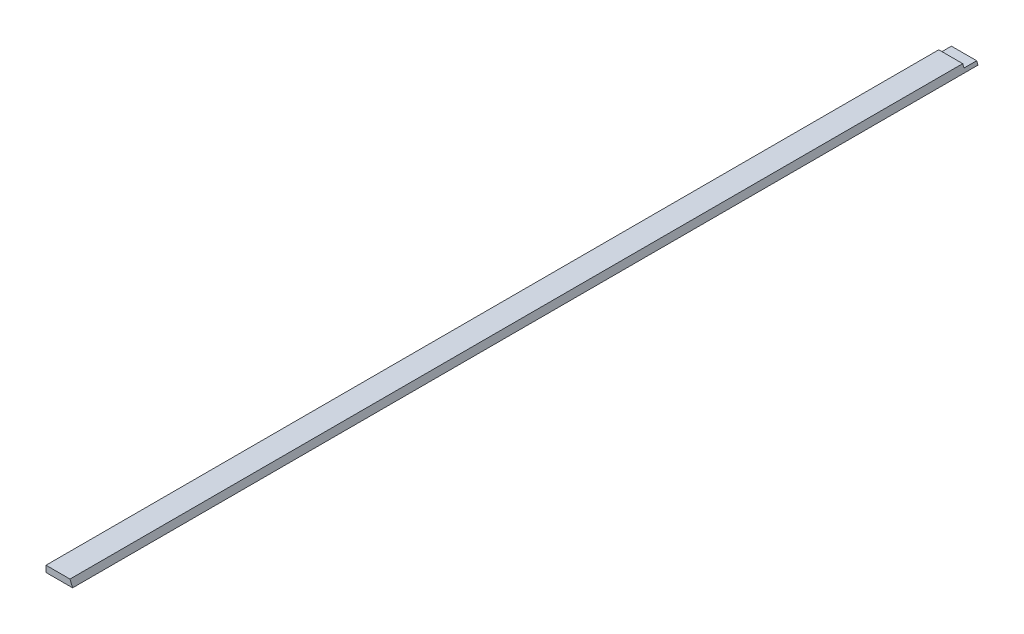
from build123d import *

# Parameters (mm, degrees)
BOSS_EXTRUDE1_DEPTH = 908.05
SKETCH2_W           = 26.67
SKETCH2_H           = 12.7
CUT_EXTRUDE1_DEPTH  = 3.175


with BuildPart() as part:
    # Sketch1 → Boss-Extrude1 (new body)
    with BuildSketch(Plane.XY):
        Polygon((0, 0), (0, 6.35), (24.039743879, 6.35), (26.67, 0), align=None)
    extrude(amount=BOSS_EXTRUDE1_DEPTH)

    # Sketch2 → Cut-Extrude1 (cut)
    with BuildSketch(Plane(origin=(0, 6.35, 0), x_dir=(1, 0, 0), z_dir=(0, 1, 0))):
        with Locations((13.335, -6.35)):
            Rectangle(SKETCH2_W, SKETCH2_H)
    extrude(amount=-CUT_EXTRUDE1_DEPTH, mode=Mode.SUBTRACT)


solid = part.part
